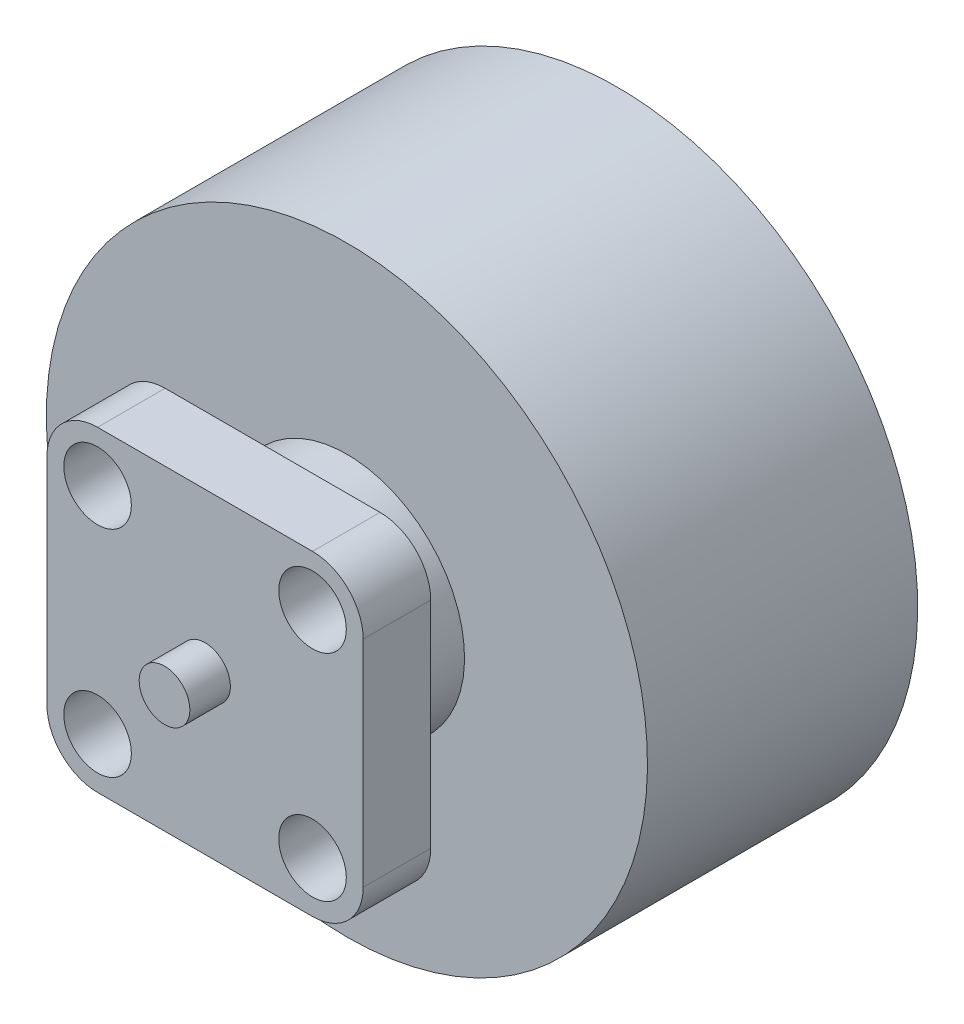
from build123d import *

# Parameters (mm, degrees)
SKETCH2_W           = 9.36396103
SKETCH2_H           = 9.36396103
SKETCH2_R           = 1
BOSS_EXTRUDE1_DEPTH = 2
FILLET1_R           = 1.5
SKETCH3_R           = 1
CUT_EXTRUDE1_DEPTH  = 2


with BuildPart() as part:
    # Sketch1 → Revolve1 (revolve)
    with BuildSketch(Plane(origin=(0, 0, 0), x_dir=(0, 0, -1), z_dir=(1, 0, 0))):
        Polygon((-1.2, 0.75), (-1.2, 0), (16.4, 0), (16.4, 0.75), (12.2, 0.75), (12.2, 8.9), (4.2, 8.9), (4.2, 3.483563445), (0, 3.483563445), (0, 0.75), align=None)
    revolve(axis=Axis((0, 0, 1.2), (0, 0, -1)))

    # Sketch2 → Boss-Extrude1 (add)
    with BuildSketch(Plane.XY):
        Rectangle(SKETCH2_W, SKETCH2_H)
        with Locations((3.181980515, 3.181980515)):
            Circle(SKETCH2_R, mode=Mode.SUBTRACT)
        with Locations((3.181980515, -3.181980515)):
            Circle(SKETCH2_R, mode=Mode.SUBTRACT)
        with Locations((-3.181980515, -3.181980515)):
            Circle(SKETCH2_R, mode=Mode.SUBTRACT)
        with Locations((-3.181980515, 3.181980515)):
            Circle(SKETCH2_R, mode=Mode.SUBTRACT)
    extrude(amount=-BOSS_EXTRUDE1_DEPTH)

    # Fillet1
    fillet1_edges = [part.edges().sort_by_distance(p)[0] for p in [
        (4.681980515, -4.681980515, -1),
        (-4.681980515, -4.681980515, -1),
        (-4.681980515, 4.681980515, -1),
        (4.681980515, 4.681980515, -1),
    ]]
    fillet(fillet1_edges, radius=FILLET1_R)

    # Sketch3 → Cut-Extrude1 (cut)
    with BuildSketch(Plane(origin=(0, 0, -12.2), x_dir=(-1, 0, 0), z_dir=(0, 0, -1))):
        with Locations((0, 2.5)):
            Circle(SKETCH3_R)
        with Locations((2.5, 0)):
            Circle(SKETCH3_R)
        with Locations((0, -2.5)):
            Circle(SKETCH3_R)
        with Locations((-2.5, 0)):
            Circle(SKETCH3_R)
    extrude(amount=-CUT_EXTRUDE1_DEPTH, mode=Mode.SUBTRACT)


solid = part.part
